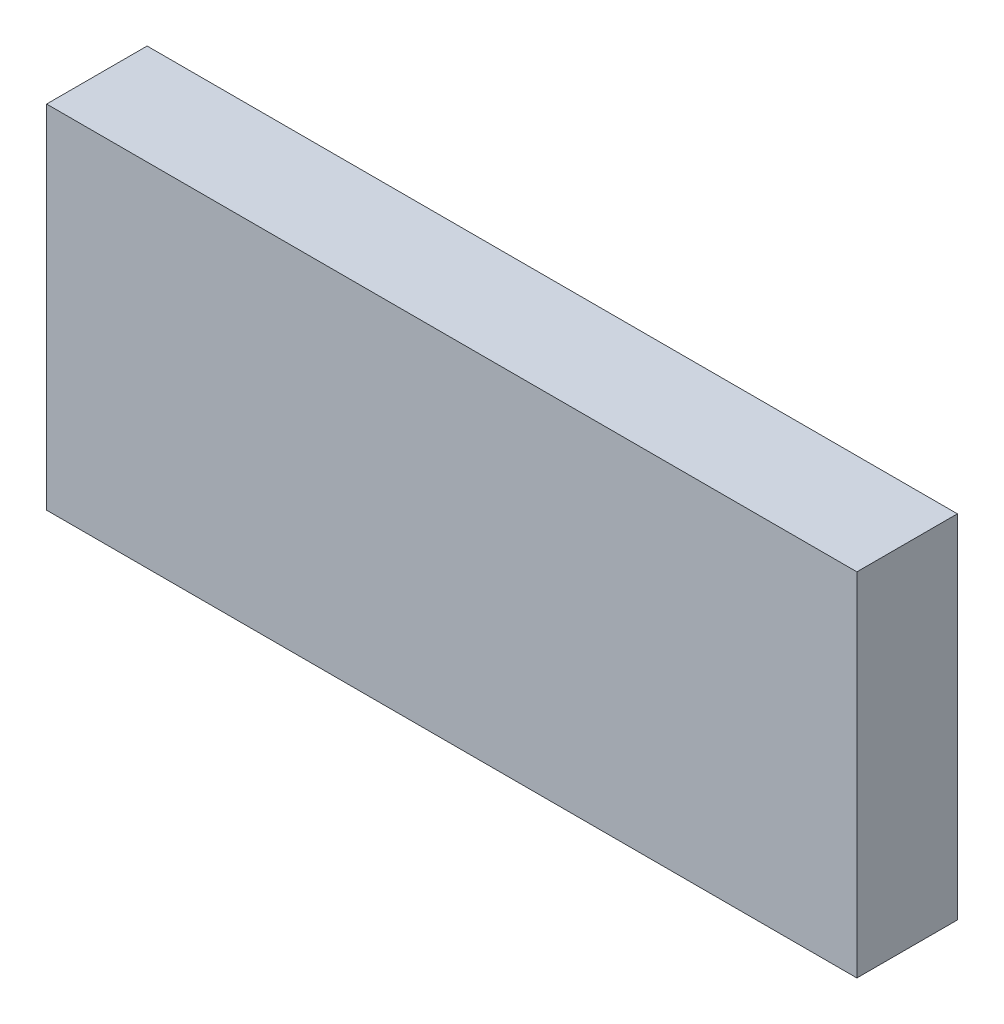
from build123d import *

# Parameters (mm, degrees)
SKETCH1_W           = 819.15
SKETCH1_H           = 355.6
BOSS_EXTRUDE1_DEPTH = 101.6


with BuildPart() as part:
    # Sketch1 → Boss-Extrude1 (new body)
    with BuildSketch(Plane.XY):
        with Locations((409.575, 177.8)):
            Rectangle(SKETCH1_W, SKETCH1_H)
    extrude(amount=BOSS_EXTRUDE1_DEPTH)


solid = part.part
